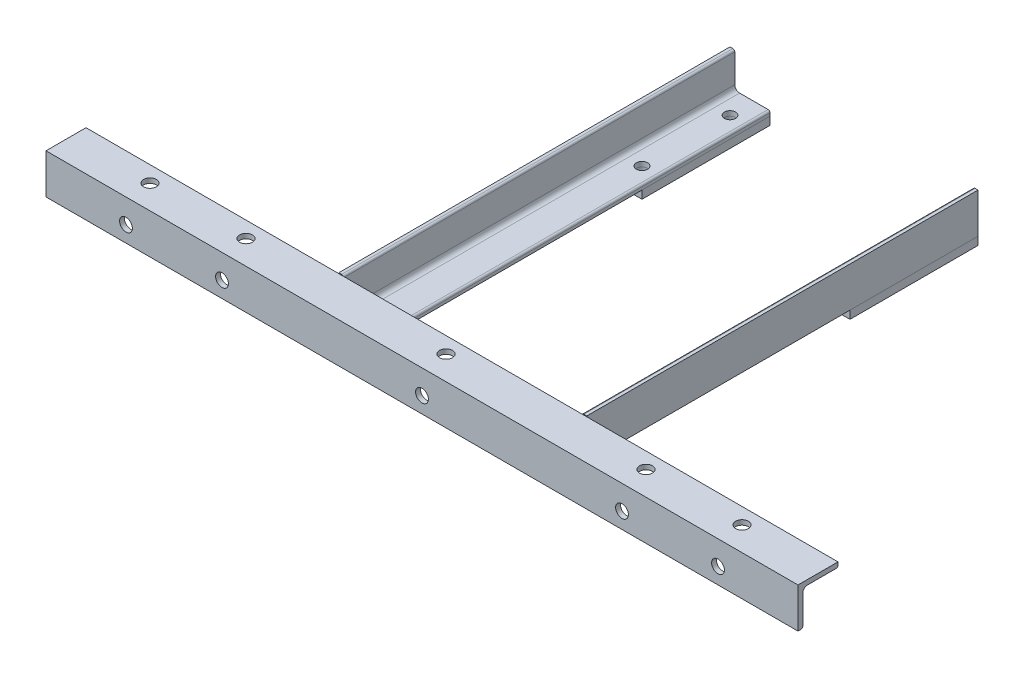
from build123d import *

# Parameters (mm, degrees)
STRUCTURAL_MEMBER1_DEPTH = 940
HOLE1_START              = 44
HOLE1_OUTLINE_R          = 8
HOLE1_DEPTH              = 6
SKETCH17_R               = 8
CUT_EXTRUDE2_DEPTH       = 476.289385533
STRUCTURAL_MEMBER2_DEPTH = 534
SKETCH16_R               = 7
MOUNTING_HOLES_DEPTH     = 713.735575091
SKETCH112_W              = 45
SKETCH112_H              = 7
CUT_EXTRUDE3_DEPTH       = 6
SKETCH118_W              = 50
SKETCH118_H              = 160
SKETCH118_R              = 8
BOSS_EXTRUDE1_DEPTH      = 10


# Read off the part's stored shape, not the designer's step: Hole1
with BuildPart() as part:
    # Sketch12 → Structural Member1 (new body)
    with BuildSketch(Plane(origin=(-470, 50, 6), x_dir=(0, 0, -1), z_dir=(-1, 0, 0))):
        with BuildLine():
            Line((0, 50), (0, 0))
            Line((0, 0), (50, 0))
            Line((50, 0), (50, 3.6))
            ThreePointArc((50, 3.6), (49.297056275, 5.297056275), (47.6, 6))
            Line((47.6, 6), (12, 6))
            ThreePointArc((12, 6), (7.757359313, 7.757359313), (6, 12))
            Line((6, 12), (6, 47.6))
            ThreePointArc((6, 47.6), (5.297056275, 49.297056275), (3.6, 50))
            Line((3.6, 50), (0, 50))
        make_face()
    extrude(amount=-STRUCTURAL_MEMBER1_DEPTH)

    # Hole1 outline → Hole1 (cut)
    with BuildSketch(Plane(origin=(0, 0, 0), x_dir=(1, 0, 0), z_dir=(0, 1, 0)).offset(HOLE1_START)):
        with Locations((-250, 24)):
            Circle(HOLE1_OUTLINE_R)
        with Locations((0, 24)):
            Circle(HOLE1_OUTLINE_R)
        with Locations((-370, 24)):
            Circle(HOLE1_OUTLINE_R)
        with Locations((370, 24)):
            Circle(HOLE1_OUTLINE_R)
        with Locations((250, 24)):
            Circle(HOLE1_OUTLINE_R)
    extrude(amount=HOLE1_DEPTH, mode=Mode.SUBTRACT)

    # Sketch17 → Cut-Extrude2 (cut, through all)
    with BuildSketch(Plane.XY.offset(6)):
        with Locations((250, 20)):
            Circle(SKETCH17_R)
        with Locations((370, 20)):
            Circle(SKETCH17_R)
        with Locations((0, 20)):
            Circle(SKETCH17_R)
        with Locations((-370, 20)):
            Circle(SKETCH17_R)
        with Locations((-250, 20)):
            Circle(SKETCH17_R)
    extrude(amount=-CUT_EXTRUDE2_DEPTH, mode=Mode.SUBTRACT)


with BuildPart() as body_2:
    # Sketch111 → Structural Member2 (new body)
    with BuildSketch(Plane(origin=(-155, 0, 0), x_dir=(1, 0, 0), z_dir=(0, 0, 1))):
        with BuildLine():
            Line((0, 50), (0, 0))
            Line((0, 0), (50, 0))
            Line((50, 0), (50, 3.6))
            ThreePointArc((50, 3.6), (49.297056275, 5.297056275), (47.6, 6))
            Line((47.6, 6), (12, 6))
            ThreePointArc((12, 6), (7.757359313, 7.757359313), (6, 12))
            Line((6, 12), (6, 47.6))
            ThreePointArc((6, 47.6), (5.297056275, 49.297056275), (3.6, 50))
            Line((3.6, 50), (0, 50))
        make_face()
    extrude(amount=-STRUCTURAL_MEMBER2_DEPTH)

    # Sketch16 → Mounting Holes (cut, through all)
    with BuildSketch(Plane(origin=(0, 6, 0), x_dir=(1, 0, 0), z_dir=(0, 1, 0))):
        with Locations(Location((-125, 504, 0), (0, 0, 270))):
            Circle(SKETCH16_R)
        with Locations(Location((-125, 394, 0), (0, 0, 270))):
            Circle(SKETCH16_R)
    extrude(amount=-MOUNTING_HOLES_DEPTH, mode=Mode.SUBTRACT)

    # Sketch112 → Cut-Extrude3 (cut)
    with BuildSketch(Plane.ZY.offset(155)):
        with Locations((-22.5, 46.5)):
            Rectangle(SKETCH112_W, SKETCH112_H)
    extrude(amount=-CUT_EXTRUDE3_DEPTH, mode=Mode.SUBTRACT)


with BuildPart() as body_3:
    # Mirror2: mirrored copy
    add(body_2.part.mirror(Plane(origin=(0, 0, 0), x_dir=(0, 0, 1), z_dir=(1, 0, 0))))


with BuildPart() as body_4:
    # Sketch118 → Boss-Extrude1 (new body)
    with BuildSketch(Plane.XZ):
        with Locations((-130, -454)):
            Rectangle(SKETCH118_W, SKETCH118_H)
        with Locations(Location((-125, -394, 0), (0, 0, 270))):
            Circle(SKETCH118_R, mode=Mode.SUBTRACT)
        with Locations(Location((-125, -504, 0), (0, 0, 270))):
            Circle(SKETCH118_R, mode=Mode.SUBTRACT)
    extrude(amount=BOSS_EXTRUDE1_DEPTH)


with BuildPart() as body_5:
    # Mirror5: mirrored copy
    add(body_4.part.mirror(Plane(origin=(0, 0, 0), x_dir=(0, 0, 1), z_dir=(1, 0, 0))))


solid = Compound([part.part, body_2.part, body_3.part, body_4.part, body_5.part])
